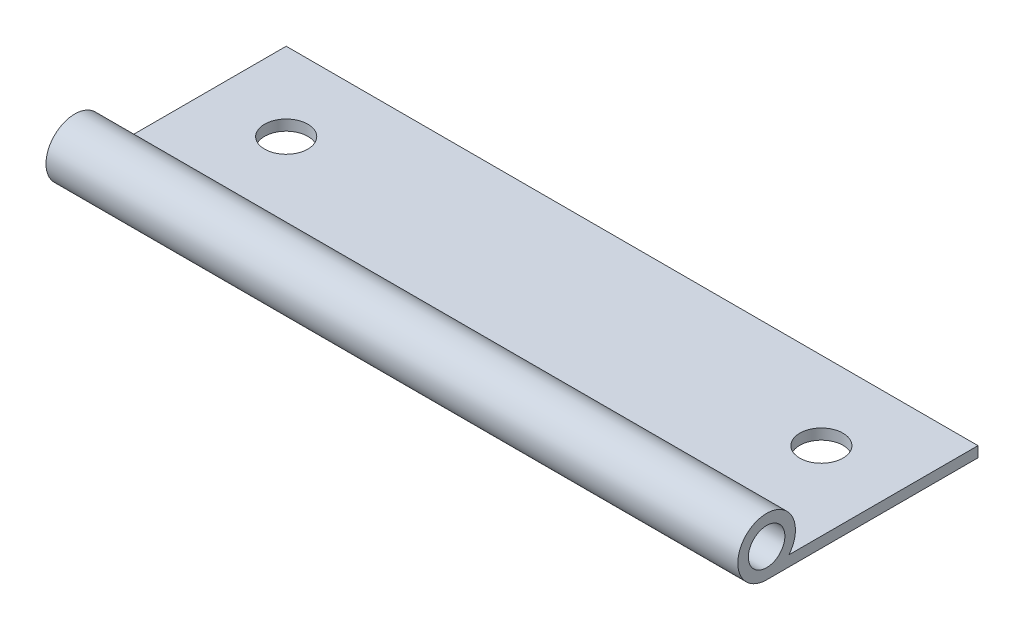
from build123d import *

# Parameters (mm, degrees)
SKETCH_1_R          = 1.9
EXTRUDE_1_DEPTH     = 72
SKETCH_2_R          = 2.25
CUT_EXTRUDE_1_DEPTH = 75.625799828


with BuildPart() as part:
    # 草图1 → 凸台-拉伸1 (new body)
    with BuildSketch(Plane(origin=(0, 0, 0), x_dir=(0, 0, -1), z_dir=(1, 0, 0))):
        with BuildLine():
            Line((0, 0), (19, 0))
            Line((19, 0), (19, -1.1))
            Line((19, -1.1), (0, -1.1))
            Line((0, -1.1), (-3, -1.1))
            ThreePointArc((-3, -1.1), (-4.284523258, 4.611088342), (-0.678362647, 0))
            Line((-0.678362647, 0), (0, 0))
        make_face()
        with Locations((-3, 1.9)):
            Circle(SKETCH_1_R, mode=Mode.SUBTRACT)
    extrude(amount=EXTRUDE_1_DEPTH)

    # 草图2 → 切除-拉伸1 (cut, through all)
    with BuildSketch(Plane(origin=(0, 0, 0), x_dir=(1, 0, 0), z_dir=(0, 1, 0))):
        with Locations((8.15, 10.85)):
            Circle(SKETCH_2_R)
        with Locations((63.85, 10.85)):
            Circle(SKETCH_2_R)
    extrude(amount=-CUT_EXTRUDE_1_DEPTH, mode=Mode.SUBTRACT)


solid = part.part
